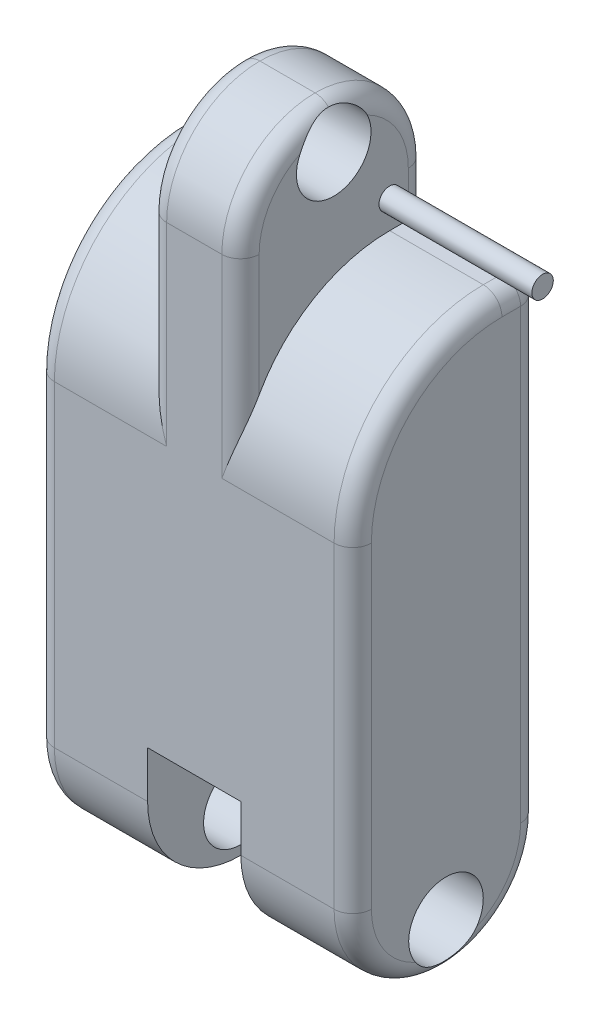
from build123d import *

# Parameters (mm, degrees)
BOSS_EXTRUDE1_DEPTH    = 100
SKETCH2_W              = 50
SKETCH2_H              = 50
CUT_EXTRUDE1_DEPTH     = 260.617025636
FILLET1_R              = 50
CUT_EXTRUDE2_DEPTH     = 25
SKETCH7_R              = 20
CUT_EXTRUDE3_DEPTH     = 299.456026912
FILLET2_R              = 50
CUT_EXTRUDE6_START     = -150
CUT_EXTRUDE6_OUTLINE_W = 50
CUT_EXTRUDE6_OUTLINE_H = 6.698729811
CUT_EXTRUDE6_DEPTH     = 50
CUT_EXTRUDE7_DEPTH     = 25
FILLET3_R              = 10
SKETCH11_W             = 50
SKETCH11_H             = 25
CUT_EXTRUDE8_DEPTH     = 99
BOSS_EXTRUDE7_DEPTH    = 0.1
FILLET4_R              = 10
SKETCH14_R             = 20
CUT_EXTRUDE9_DEPTH     = 269.797414422
SKETCH15_R             = 5.75
BOSS_EXTRUDE8_DEPTH    = 82
FILLET5_R              = 80
FILLET6_R              = 10


with BuildPart() as part:
    # Sketch1 → Boss-Extrude1 (new body)
    with BuildSketch(Plane.XY):
        Polygon((-24.8, 150), (-24.8, 224), (24.8, 224), (24.8, 150), (85, 150), (85, -150), (-85, -150), (-85, 150), align=None)
    extrude(amount=-BOSS_EXTRUDE1_DEPTH)

    # Sketch2 → Cut-Extrude1 (cut, through all)
    with BuildSketch(Plane.XY):
        with Locations((0, -150)):
            Rectangle(SKETCH2_W, SKETCH2_H)
    extrude(amount=-CUT_EXTRUDE1_DEPTH, mode=Mode.SUBTRACT)

    # Fillet1
    fillet1_edges = [part.edges().sort_by_distance(p)[0] for p in [
        (0, 224, -100),
        (0, 224, 0),
    ]]
    fillet(fillet1_edges, radius=FILLET1_R - 0.0001)  # a hair under: the kernel refuses the full size

    # Sketch6 → Cut-Extrude2 (cut, symmetric)
    with BuildSketch(Plane(origin=(0, 0, 0), x_dir=(0, 0, -1), z_dir=(1, 0, 0))):
        with BuildLine():
            Line((100, -125), (0, -125))
            ThreePointArc((0, -125), (50, -75), (100, -125))
        make_face()
    extrude(amount=CUT_EXTRUDE2_DEPTH, both=True, mode=Mode.SUBTRACT)

    # Sketch7 → Cut-Extrude3 (cut, through all)
    with BuildSketch(Plane.ZY.offset(85)):
        with Locations(Location((-50, -125, 0), (0, 0, 270))):
            Circle(SKETCH7_R)
    extrude(amount=-CUT_EXTRUDE3_DEPTH, mode=Mode.SUBTRACT)

    # Fillet2
    fillet2_edges = [part.edges().sort_by_distance(p)[0] for p in [
        (-55, -150, -100),
        (-55, -150, 0),
    ]]
    fillet(fillet2_edges, radius=FILLET2_R - 0.0001)  # a hair under: the kernel refuses the full size

    # Cut-Extrude6: read off the stored shape, not the designer's step
    # Cut-Extrude6 outline → Cut-Extrude6 (cut)
    with BuildSketch(Plane(origin=(0, 0, 0), x_dir=(1, 0, 0), z_dir=(0, 1, 0)).offset(CUT_EXTRUDE6_START)):
        with Locations((0, 96.650635095)):
            Rectangle(CUT_EXTRUDE6_OUTLINE_W, CUT_EXTRUDE6_OUTLINE_H)
        with Locations((0, 3.349364906)):
            Rectangle(CUT_EXTRUDE6_OUTLINE_W, CUT_EXTRUDE6_OUTLINE_H)
    extrude(amount=CUT_EXTRUDE6_DEPTH, mode=Mode.SUBTRACT)

    # Sketch10 → Cut-Extrude7 (cut, symmetric)
    with BuildSketch(Plane(origin=(0, 0, 0), x_dir=(0, 0, -1), z_dir=(1, 0, 0))):
        with BuildLine():
            Line((0, -100), (100, -100))
            ThreePointArc((100, -100), (50, -86.611517322), (0, -100))
        make_face()
    extrude(amount=CUT_EXTRUDE7_DEPTH, both=True, mode=Mode.SUBTRACT)

    # Fillet3
    fillet3_edges = [part.edges().sort_by_distance(p)[0] for p in [
        (24.8, 162.00005, -100),
        (-54.9, 150, -100),
        (-24.8, 162.00005, 0),
        (-24.8, 162.00005, -100),
        (-24.8, 209.355368349, -14.644631651),
        (-24.8, 209.355368349, -85.355368349),
        (24.8, 209.355368349, -14.644631651),
        (24.8, 209.355368349, -85.355368349),
        (54.9, 150, -100),
        (24.8, 162.00005, 0),
    ]]
    fillet(fillet3_edges, radius=FILLET3_R)

    # Sketch11 → Cut-Extrude8 (cut)
    with BuildSketch(Plane.XY):
        with Locations((0, -87.5)):
            Rectangle(SKETCH11_W, SKETCH11_H)
    extrude(amount=-CUT_EXTRUDE8_DEPTH, mode=Mode.SUBTRACT)

    # Sketch14 → Cut-Extrude9 (cut, through all)
    with BuildSketch(Plane(origin=(24.8, 0, 0), x_dir=(0, 0, -1), z_dir=(1, 0, 0))):
        with Locations(Location((50, 201, 0), (0, 0, 25.856016698))):
            Circle(SKETCH14_R)
    extrude(amount=-CUT_EXTRUDE9_DEPTH, mode=Mode.SUBTRACT)

    # Sketch15 → Boss-Extrude8 (add)
    with BuildSketch(Plane(origin=(24.8, 0, 0), x_dir=(0, 0, -1), z_dir=(1, 0, 0))):
        with Locations((80, 165)):
            Circle(SKETCH15_R)
    extrude(amount=BOSS_EXTRUDE8_DEPTH)

    # Fillet5
    fillet5_edges = [part.edges().sort_by_distance(p)[0] for p in [
        (-49.9, 150, 0),
        (49.9, 150, 0),
    ]]
    fillet(fillet5_edges, radius=FILLET5_R)

    # Fillet6
    # the kernel refuses this fillet: 10 mm, written as the material it takes off along each edge
    with BuildSketch(Plane(origin=(-85, -100.0001, -100), x_dir=(0, 0, 1), z_dir=(0, 1, 0)), Plane(origin=(85, 140, -100), x_dir=(0, 0, 1), z_dir=(0, -1, 0))) as fillet6_piece_1:
        with BuildLine():
            CenterArc((FILLET6_R, FILLET6_R), FILLET6_R, 180, 90)
            Line((0, FILLET6_R), (0, 0))
            Line((0, 0), (FILLET6_R, 0))
        make_face()
    extrude(amount=240.0001, mode=Mode.SUBTRACT)
    with BuildSketch(Plane(origin=(85, 150, -80), x_dir=(0, -1, 0), z_dir=(0, 0, -1))) as fillet6_piece_2:
        with BuildLine():
            CenterArc((FILLET6_R, FILLET6_R), FILLET6_R, 180, 90)
            Line((0, FILLET6_R), (0, 0))
            Line((0, 0), (FILLET6_R, 0))
        make_face()
    extrude(amount=10, mode=Mode.SUBTRACT)
    with BuildSketch(Plane(origin=(85, 140, -90), x_dir=(0, 1, 0), z_dir=(0, 0, 1))) as fillet6_piece_3:
        with BuildLine():
            CenterArc((10 - FILLET6_R, FILLET6_R), FILLET6_R, 270, 90)
            Line((10, FILLET6_R), (10, 0))
            Line((10, 0), (10 - FILLET6_R, 0))
        make_face()
    revolve(axis=Axis((85, 140, -90), (-1, 0, 0)), revolution_arc=90, mode=Mode.SUBTRACT)
    with BuildSketch(Plane(origin=(-85, 150, -80), x_dir=(0, -1, 0), z_dir=(0, 0, -1))) as fillet6_piece_4:
        with BuildLine():
            CenterArc((FILLET6_R, -FILLET6_R), FILLET6_R, 90, 90)
            Line((0, -FILLET6_R), (0, 0))
            Line((0, 0), (FILLET6_R, 0))
        make_face()
    extrude(amount=10, mode=Mode.SUBTRACT)
    with BuildSketch(Plane(origin=(-85, 140, -90), x_dir=(0, 1, 0), z_dir=(0, 0, 1))) as fillet6_piece_5:
        with BuildLine():
            CenterArc((10 - FILLET6_R, -FILLET6_R), FILLET6_R, 360, 90)
            Line((10, -FILLET6_R), (10, 0))
            Line((10, 0), (10 - FILLET6_R, 0))
        make_face()
    revolve(axis=Axis((-85, 140, -90), (-1, 0, 0)), revolution_arc=90, mode=Mode.SUBTRACT)
    with BuildSketch(Plane(origin=(-85, -100.0001, 0), x_dir=(1, 0, 0), z_dir=(0, 1, 0)), Plane(origin=(85, 70, 0), x_dir=(-1, 0, 0), z_dir=(0, -1, 0))) as fillet6_piece_6:
        with BuildLine():
            CenterArc((FILLET6_R, FILLET6_R), FILLET6_R, 180, 90)
            Line((0, FILLET6_R), (0, 0))
            Line((0, 0), (FILLET6_R, 0))
        make_face()
    extrude(amount=170.0001, mode=Mode.SUBTRACT)
    with BuildSketch(Plane(origin=(-85, 70, -80), x_dir=(0, 0, 1), z_dir=(0, -1, 0))) as fillet6_piece_7:
        with BuildLine():
            CenterArc((80 - FILLET6_R, -FILLET6_R), FILLET6_R, 0, 90)
            Line((80 - FILLET6_R, 0), (80, 0))
            Line((80, 0), (80, -FILLET6_R))
        make_face()
    revolve(axis=Axis((-85, 70, -80), (-1, 0, 0)), revolution_arc=90, mode=Mode.SUBTRACT)
    with BuildSketch(Plane(origin=(85, 70, -80), x_dir=(0, 0, 1), z_dir=(0, -1, 0))) as fillet6_piece_8:
        with BuildLine():
            CenterArc((80 - FILLET6_R, FILLET6_R), FILLET6_R, 270, 90)
            Line((80 - FILLET6_R, 0), (80, 0))
            Line((80, 0), (80, FILLET6_R))
        make_face()
    revolve(axis=Axis((85, 70, -80), (-1, 0, 0)), revolution_arc=90, mode=Mode.SUBTRACT)
    with BuildSketch(Plane(origin=(85, -100.0001, -49.9999), x_dir=(0, 0, 1), z_dir=(0, 1, 0))) as fillet6_piece_9:
        with BuildLine():
            CenterArc((49.9999 - FILLET6_R, -FILLET6_R), FILLET6_R, 360, 90)
            Line((49.9999, -FILLET6_R), (49.9999, 0))
            Line((49.9999, 0), (49.9999 - FILLET6_R, 0))
        make_face()
    revolve(axis=Axis((85, -100.0001, -49.9999), (1, 0, 0)), revolution_arc=90, mode=Mode.SUBTRACT)
    with BuildSketch(Plane(origin=(85, -100.0001, -50.0001), x_dir=(0, 0, -1), z_dir=(0, 1, 0))) as fillet6_piece_10:
        with BuildLine():
            CenterArc((49.9999 - FILLET6_R, FILLET6_R), FILLET6_R, 270, 90)
            Line((49.9999, FILLET6_R), (49.9999, 0))
            Line((49.9999, 0), (49.9999 - FILLET6_R, 0))
        make_face()
    revolve(axis=Axis((85, -100.0001, -50.0001), (-1, 0, 0)), revolution_arc=90, mode=Mode.SUBTRACT)
    with BuildSketch(Plane(origin=(-85, -100.0001, -49.9999), x_dir=(0, 0, 1), z_dir=(0, 1, 0))) as fillet6_piece_11:
        with BuildLine():
            CenterArc((49.9999 - FILLET6_R, FILLET6_R), FILLET6_R, 270, 90)
            Line((49.9999, FILLET6_R), (49.9999, 0))
            Line((49.9999, 0), (49.9999 - FILLET6_R, 0))
        make_face()
    revolve(axis=Axis((-85, -100.0001, -49.9999), (1, 0, 0)), revolution_arc=90, mode=Mode.SUBTRACT)
    with BuildSketch(Plane(origin=(-85, -100.0001, -50.0001), x_dir=(0, 0, -1), z_dir=(0, 1, 0))) as fillet6_piece_12:
        with BuildLine():
            CenterArc((49.9999 - FILLET6_R, -FILLET6_R), FILLET6_R, 0, 90)
            Line((49.9999, -FILLET6_R), (49.9999, 0))
            Line((49.9999, 0), (49.9999 - FILLET6_R, 0))
        make_face()
    revolve(axis=Axis((-85, -100.0001, -50.0001), (-1, 0, 0)), revolution_arc=90, mode=Mode.SUBTRACT)
    with BuildSketch(Plane(origin=(-85, -150, -49.9999), x_dir=(0, 1, 0), z_dir=(0, 0, -1))) as fillet6_piece_13:
        with BuildLine():
            CenterArc((FILLET6_R, FILLET6_R), FILLET6_R, 180, 90)
            Line((0, FILLET6_R), (0, 0))
            Line((0, 0), (FILLET6_R, 0))
        make_face()
    extrude(amount=0.0002, mode=Mode.SUBTRACT)
    with BuildSketch(Plane(origin=(85, -150, -49.9999), x_dir=(0, 1, 0), z_dir=(0, 0, -1))) as fillet6_piece_14:
        with BuildLine():
            CenterArc((FILLET6_R, -FILLET6_R), FILLET6_R, 90, 90)
            Line((0, -FILLET6_R), (0, 0))
            Line((0, 0), (FILLET6_R, 0))
        make_face()
    extrude(amount=0.0002, mode=Mode.SUBTRACT)


with BuildPart() as body_2:
    # Sketch13 → Boss-Extrude7 (new body)
    with BuildSketch(Plane(origin=(0, 0, -100), x_dir=(-1, 0, 0), z_dir=(0, 0, -1))):
        Polygon((-25, -100), (-25, -130), (25.018802851, -130), (25, -100), align=None)
    extrude(amount=BOSS_EXTRUDE7_DEPTH)

    # Fillet4
    # the kernel refuses this fillet: 10 mm, written as the material it takes off along each edge
    with BuildSketch(Plane(origin=(-25.021013242, -133.526683302, -100.1), x_dir=(0, 0, 1), z_dir=(0.0006267615930631998, 0.9999998035849335, 0))) as fillet4_piece_1:
        with BuildLine():
            CenterArc((10, 1.410673598), FILLET4_R, 180, 8.109614456)
            Line((0, 1.410673598), (0, 0))
            Line((0, 0), (0.1, 0))
        make_face()
    extrude(amount=37.053373882, mode=Mode.SUBTRACT)
    with BuildSketch(Plane(origin=(25, -96.473316005, -100.1), x_dir=(0, 0, 1), z_dir=(0, -1, 0))) as fillet4_piece_2:
        with BuildLine():
            CenterArc((10, 1.410673598), FILLET4_R, 180, 8.109614456)
            Line((0, 1.410673598), (0, 0))
            Line((0, 0), (0.1, 0))
        make_face()
    extrude(amount=37.05336799, mode=Mode.SUBTRACT)
    with BuildSketch(Plane(origin=(28.526683995, -130, -100.1), x_dir=(0, 0, 1), z_dir=(-1, 0, 0))) as fillet4_piece_3:
        with BuildLine():
            CenterArc((10, 1.410673598), FILLET4_R, 180, 8.109614456)
            Line((0, 1.410673598), (0, 0))
            Line((0, 0), (0.1, 0))
        make_face()
    extrude(amount=57.072170841, mode=Mode.SUBTRACT)


solid = Compound([part.part, body_2.part])
